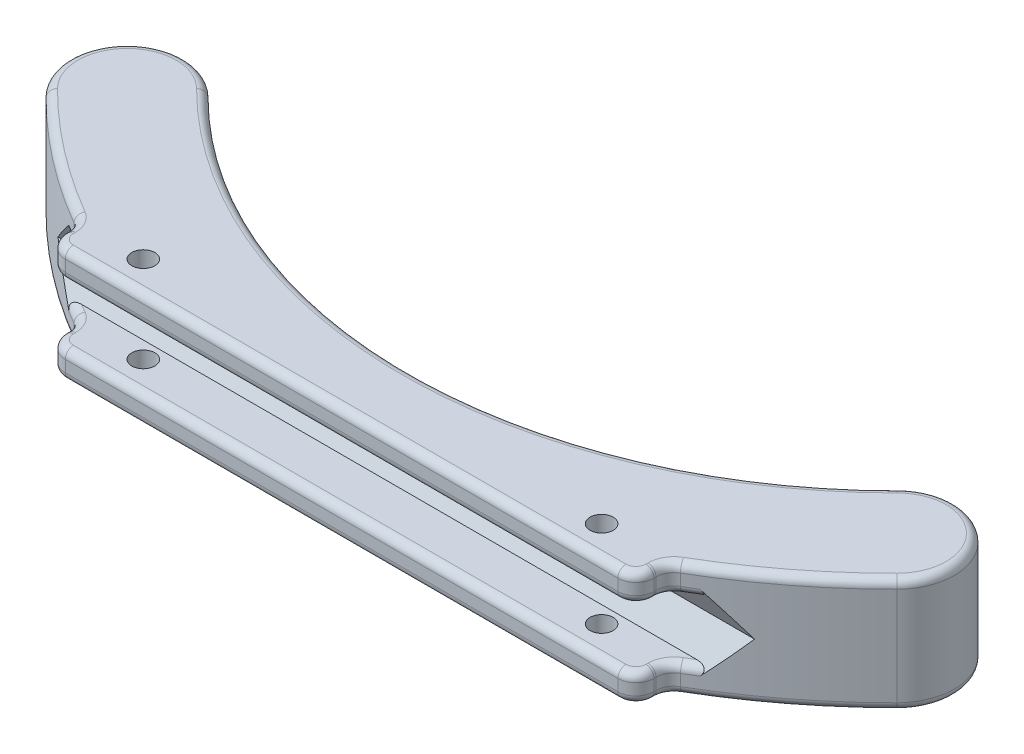
from build123d import *

# Parameters (mm, degrees)
BOSS_EXTRUDE1_DEPTH     = 12.7
CUT_EXTRUDE1_DEPTH      = 109.095060565
CUT_EXTRUDE1_DEPTH_BACK = 109.095060565
F_10_CLEARANCE_HOLE2_D  = 5.1054
SKETCH8_W               = 130.510344418
SKETCH8_H               = 6.15
BOSS_EXTRUDE2_DEPTH     = 3
FILLET1_R               = 4
FILLET2_R               = 1.8


with BuildPart() as part:
    # Sketch1 → Boss-Extrude1 (new, symmetric)
    with BuildSketch(Plane(origin=(0, 0, 0), x_dir=(1, 0, 0), z_dir=(0, 1, 0))):
        with BuildLine():
            Line((-65.255172209, 0), (-65.255172209, -3.78))
            Line((-65.255172209, -3.78), (65.255172209, -3.78))
            Line((65.255172209, -3.78), (65.255172209, 0))
            ThreePointArc((65.255172209, 0), (80.547764726, 10.012717744), (94.32804461, 22.02195539))
            ThreePointArc((94.32804461, 22.02195539), (94.32804461, 39.982467632), (76.367532368, 39.982467632))
            ThreePointArc((76.367532368, 39.982467632), (0, 8.35), (-76.367532368, 39.982467632))
            ThreePointArc((-76.367532368, 39.982467632), (-94.32804461, 39.982467632), (-94.32804461, 22.02195539))
            ThreePointArc((-94.32804461, 22.02195539), (-80.547764726, 10.012717744), (-65.255172209, 0))
        make_face()
    extrude(amount=BOSS_EXTRUDE1_DEPTH, both=True)

    # Sketch3 → Cut-Extrude1 (cut, two sides: drawn at the far end of the back side and taken through both)
    with BuildSketch(Plane(origin=(0, 0, 0), x_dir=(0, 0, -1), z_dir=(1, 0, 0)).offset(-CUT_EXTRUDE1_DEPTH_BACK)):
        Polygon((-7.563288526, 0), (-3.781644263, -6.55), (3.781644263, -6.55), (7.563288526, 0), (3.781644263, 6.55), (-3.781644263, 6.55), align=None)
    extrude(amount=CUT_EXTRUDE1_DEPTH + CUT_EXTRUDE1_DEPTH_BACK, mode=Mode.SUBTRACT)

    # #10 Clearance Hole2 (through all)
    with Locations(Plane(origin=(0, 12.7, 0), x_dir=(1, 0, 0), z_dir=(0, 1, 0))):
        with Locations((-50.8, 0.065822132), (50.8, 0.065822132)):
            Hole(F_10_CLEARANCE_HOLE2_D / 2)

    # Sketch8 → Boss-Extrude2 (add)
    with BuildSketch(Plane.XY.offset(3.78)):
        with Locations((0, -9.625)):
            Rectangle(SKETCH8_W, SKETCH8_H)
        with Locations((0, 9.625)):
            Rectangle(SKETCH8_W, SKETCH8_H)
    extrude(amount=BOSS_EXTRUDE2_DEPTH)

    # Fillet1
    fillet1_edges = [part.edges().sort_by_distance(p)[0] for p in [
        (-65.255172209, -9.625, 6.78),
        (-65.255172209, 9.625, 6.78),
        (65.255172209, 9.625, 6.78),
        (65.255172209, -9.625, 6.78),
        (65.255172209, -9.625, 0),
        (65.255172209, 9.625, 0),
        (-65.255172209, -9.625, 0),
        (-65.255172209, 9.625, 0),
    ]]
    fillet(fillet1_edges, radius=FILLET1_R)

    # Fillet2
    fillet2_edges = [part.edges().sort_by_distance(p)[0] for p in [
        (69.422917101, -6.55, -2.437671514),
        (65.786408101, -6.55, 0.327727662),
        (65.255172209, -6.55, 2.54981508),
        (64.083599334, -6.55, 5.608427125),
        (-69.422917101, -6.55, -2.437671514),
        (-65.786408101, -6.55, 0.327727662),
        (-65.255172209, -6.55, 2.54981508),
        (-64.083599334, -6.55, 5.608427125),
        (69.422917101, 6.55, -2.437671514),
        (65.786408101, 6.55, 0.327727662),
        (65.255172209, 6.55, 2.54981508),
        (-69.422917101, 6.55, -2.437671514),
        (-65.786408101, 6.55, 0.327727662),
        (-65.255172209, 6.55, 2.54981508),
        (-64.083599334, 6.55, 5.608427125),
        (0, 6.55, 6.78),
        (65.786408101, -12.7, 0.327727662),
        (65.255172209, -12.7, 2.54981508),
        (64.083599334, -12.7, 5.608427125),
        (0, -12.7, 6.78),
        (-64.083599334, -12.7, 5.608427125),
        (-65.255172209, -12.7, 2.54981508),
        (-65.786408101, -12.7, 0.327727662),
        (-81.455776786, -12.7, -10.706654596),
        (-94.32804461, -12.7, -39.982467632),
        (0, -12.7, -8.35),
        (94.32804461, -12.7, -39.982467632),
        (-94.32804461, 12.7, -39.982467632),
        (0, 12.7, -8.35),
        (94.32804461, 12.7, -39.982467632),
        (81.455776786, 12.7, -10.706654596),
        (65.786408101, 12.7, 0.327727662),
        (65.255172209, 12.7, 2.54981508),
        (64.083599334, 12.7, 5.608427125),
        (0, 12.7, 6.78),
        (-64.083599334, 12.7, 5.608427125),
        (-65.255172209, 12.7, 2.54981508),
        (-65.786408101, 12.7, 0.327727662),
        (0, -6.55, 6.78),
        (64.083599334, 6.55, 5.608427125),
        (81.455776786, -12.7, -10.706654596),
        (-81.455776786, 12.7, -10.706654596),
    ]]
    fillet(fillet2_edges, radius=FILLET2_R)


solid = part.part
